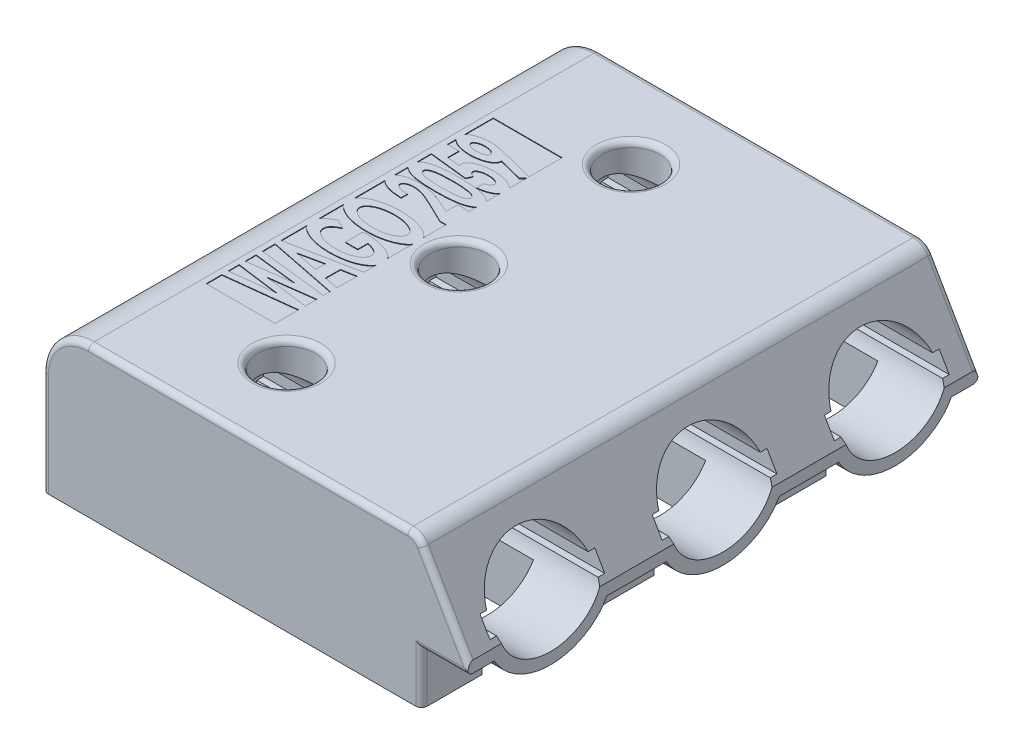
from build123d import *

# Parameters (mm, degrees)
SKETCH1_W           = 7.4
SKETCH1_H           = 8.9
BOSS_EXTRUDE1_DEPTH = 2.6
SKETCH2_RX          = 0.9
SKETCH2_RY          = 0.8
CUT_EXTRUDE1_DEPTH  = 6
CUT_EXTRUDE2_REACH  = 13.863
SKETCH3_R           = 0.5
SKETCH4_W           = 2
SKETCH4_H           = 0.3
CUT_EXTRUDE3_DEPTH  = 6
CHAMFER2_SIZE       = 1.5
CHAMFER2_SIZE_2     = 0.866025404
SKETCH5_W           = 5.5
SKETCH5_H           = 1.6
CUT_EXTRUDE4_DEPTH  = 0.4
SKETCH6_W           = 0.8
SKETCH6_H           = 0.8
SKETCH6_W_2         = 1.1
CUT_EXTRUDE5_DEPTH  = 0.2
CUT_EXTRUDE6_REACH  = 13.782
SKETCH7_W           = 3.6
SKETCH7_H           = 1.6
FILLET1_R           = 0.8
FILLET2_R           = 0.1
CUT_EXTRUDE7_DEPTH  = 0.8
FILLET3_R           = 0.1
FILLET4_R           = 0.3
SKETCH10_W          = 1.2
SKETCH10_H          = 5
CUT_EXTRUDE8_DEPTH  = 0.01
BOSS_EXTRUDE2_DEPTH = 0.01


with BuildPart() as part:
    # Sketch1 → Boss-Extrude1 (new body)
    with BuildSketch(Plane(origin=(0, 0, 0), x_dir=(1, 0, 0), z_dir=(0, 1, 0))):
        with Locations((3.7, 4.45)):
            Rectangle(SKETCH1_W, SKETCH1_H)
    extrude(amount=BOSS_EXTRUDE1_DEPTH)

    # Sketch2 → Cut-Extrude1 (cut)
    with BuildSketch(Plane(origin=(7.4, 0, 0), x_dir=(0, 0, -1), z_dir=(1, 0, 0))):
        with Locations((1.45, 1.35)):
            Ellipse(SKETCH2_RX, SKETCH2_RY)
        with Locations((4.45, 1.35)):
            Ellipse(SKETCH2_RX, SKETCH2_RY)
        with Locations((7.45, 1.35)):
            Ellipse(SKETCH2_RX, SKETCH2_RY)
    extrude(amount=-CUT_EXTRUDE1_DEPTH, mode=Mode.SUBTRACT)

    # Sketch3 → Cut-Extrude2 (cut, up to next)
    with BuildSketch(Plane(origin=(0, 2.6, 0), x_dir=(1, 0, 0), z_dir=(0, 1, 0)), mode=Mode.PRIVATE) as cut_extrude2_sk1:
        with Locations(Location((2.8, 1.45, 0), (0, 0, 270))):
            Circle(SKETCH3_R)
    cut_extrude2_tool1 = extrude(cut_extrude2_sk1.sketch, amount=-CUT_EXTRUDE2_REACH, mode=Mode.PRIVATE) & part.part
    # Sketch3 → Cut-Extrude2 (cut, up to next)
    with BuildSketch(Plane(origin=(0, 2.6, 0), x_dir=(1, 0, 0), z_dir=(0, 1, 0)), mode=Mode.PRIVATE) as cut_extrude2_sk2:
        with Locations(Location((2.8, 4.45, 0), (0, 0, 270))):
            Circle(SKETCH3_R)
    cut_extrude2_tool2 = extrude(cut_extrude2_sk2.sketch, amount=-CUT_EXTRUDE2_REACH, mode=Mode.PRIVATE) & part.part
    # Sketch3 → Cut-Extrude2 (cut, up to next)
    with BuildSketch(Plane(origin=(0, 2.6, 0), x_dir=(1, 0, 0), z_dir=(0, 1, 0)), mode=Mode.PRIVATE) as cut_extrude2_sk3:
        with Locations(Location((2.8, 7.45, 0), (0, 0, 270))):
            Circle(SKETCH3_R)
    cut_extrude2_tool3 = extrude(cut_extrude2_sk3.sketch, amount=-CUT_EXTRUDE2_REACH, mode=Mode.PRIVATE) & part.part
    add(cut_extrude2_tool1.solids().sort_by_distance((2.8, 2.6, -1.45))[0], mode=Mode.SUBTRACT)
    add(cut_extrude2_tool2.solids().sort_by_distance((2.8, 2.6, -4.45))[0], mode=Mode.SUBTRACT)
    add(cut_extrude2_tool3.solids().sort_by_distance((2.8, 2.6, -7.45))[0], mode=Mode.SUBTRACT)

    # Sketch4 → Cut-Extrude3 (cut)
    with BuildSketch(Plane(origin=(7.4, 0, 0), x_dir=(0, 0, -1), z_dir=(1, 0, 0))):
        with Locations((1.45, 1.35)):
            Rectangle(SKETCH4_W, SKETCH4_H)
        with Locations((4.45, 1.35)):
            Rectangle(SKETCH4_W, SKETCH4_H)
        with Locations((7.45, 1.35)):
            Rectangle(SKETCH4_W, SKETCH4_H)
    extrude(amount=-CUT_EXTRUDE3_DEPTH, mode=Mode.SUBTRACT)

    # Chamfer2
    # the kernel refuses this chamfer: 1.5, 0.866025404 mm, written as the material it takes off along each edge
    with BuildSketch(Plane(origin=(7.4, 2.6, 3.880628632), x_dir=(0.019326765612700865, -0.999813220622208, 0), z_dir=(0, 0, -1))) as chamfer2_piece_1:
        Polygon((CHAMFER2_SIZE * 0.999813220622, CHAMFER2_SIZE * 0.0193267656127), (-CHAMFER2_SIZE_2 * 0.0193267656079, CHAMFER2_SIZE_2 * 0.999813220373), (0, 0), align=None)
    extrude(amount=16.661257264, mode=Mode.SUBTRACT)

    # Sketch5 → Cut-Extrude4 (cut)
    with BuildSketch(Plane.XZ):
        with Locations((3.55, -7.45)):
            Rectangle(SKETCH5_W, SKETCH5_H)
        with Locations((3.55, -4.45)):
            Rectangle(SKETCH5_W, SKETCH5_H)
        with Locations((3.55, -1.45)):
            Rectangle(SKETCH5_W, SKETCH5_H)
    extrude(amount=-CUT_EXTRUDE4_DEPTH, mode=Mode.SUBTRACT)

    # Sketch6 → Cut-Extrude5 (cut)
    with BuildSketch(Plane.XZ):
        with Locations((0.4, -7.45)):
            Rectangle(SKETCH6_W, SKETCH6_H)
        with Locations((0.4, -4.45)):
            Rectangle(SKETCH6_W, SKETCH6_H)
        with Locations((0.4, -1.45)):
            Rectangle(SKETCH6_W, SKETCH6_H)
        with Locations((6.85, -7.45)):
            Rectangle(SKETCH6_W_2, SKETCH6_H)
        with Locations((6.85, -4.45)):
            Rectangle(SKETCH6_W_2, SKETCH6_H)
        with Locations((6.85, -1.45)):
            Rectangle(SKETCH6_W_2, SKETCH6_H)
    extrude(amount=-CUT_EXTRUDE5_DEPTH, mode=Mode.SUBTRACT)

    # Sketch7 → Cut-Extrude6 (cut, up to next)
    with BuildSketch(Plane.XZ.offset(-0.4), mode=Mode.PRIVATE) as cut_extrude6_sk1:
        with Locations((4.5, -7.45)):
            Rectangle(SKETCH7_W, SKETCH7_H)
    cut_extrude6_tool1 = extrude(cut_extrude6_sk1.sketch, amount=-CUT_EXTRUDE6_REACH, mode=Mode.PRIVATE) & part.part
    # Sketch7 → Cut-Extrude6 (cut, up to next)
    with BuildSketch(Plane.XZ.offset(-0.4), mode=Mode.PRIVATE) as cut_extrude6_sk2:
        with Locations((4.5, -4.45)):
            Rectangle(SKETCH7_W, SKETCH7_H)
    cut_extrude6_tool2 = extrude(cut_extrude6_sk2.sketch, amount=-CUT_EXTRUDE6_REACH, mode=Mode.PRIVATE) & part.part
    # Sketch7 → Cut-Extrude6 (cut, up to next)
    with BuildSketch(Plane.XZ.offset(-0.4), mode=Mode.PRIVATE) as cut_extrude6_sk3:
        with Locations((4.5, -1.45)):
            Rectangle(SKETCH7_W, SKETCH7_H)
    cut_extrude6_tool3 = extrude(cut_extrude6_sk3.sketch, amount=-CUT_EXTRUDE6_REACH, mode=Mode.PRIVATE) & part.part
    add(cut_extrude6_tool1.solids().sort_by_distance((4.5, 0.4, -7.45))[0], mode=Mode.SUBTRACT)
    add(cut_extrude6_tool2.solids().sort_by_distance((4.5, 0.4, -4.45))[0], mode=Mode.SUBTRACT)
    add(cut_extrude6_tool3.solids().sort_by_distance((4.5, 0.4, -1.45))[0], mode=Mode.SUBTRACT)

    # Fillet1
    fillet1_edges = [part.edges().sort_by_distance(p)[0] for p in [
        (0, 2.6, -4.45),
    ]]
    fillet(fillet1_edges, radius=FILLET1_R)

    # Fillet2
    fillet2_edges = [part.edges().sort_by_distance(p)[0] for p in [
        (2.8, 2.6, -1.95),
        (2.8, 2.6, -4.95),
        (2.8, 2.6, -7.95),
    ]]
    fillet(fillet2_edges, radius=FILLET2_R)

    # Sketch8 → Cut-Extrude7 (cut)
    with BuildSketch(Plane(origin=(7.4, 0, 0), x_dir=(0, 0, -1), z_dir=(1, 0, 0))):
        with BuildLine():
            Line((0, 0), (0, 0.9))
            Line((0, 0.9), (0.46766859, 0.9))
            add(Edge.make_bspline(
                [(0.46766859, 0.9), (1.45, -0.872222222), (2.43233141, 0.9)],
                knots=[3.608357993, 3.608357993, 3.608357993, 5.816419968, 5.816419968, 5.816419968], degree=2, weights=[1, 0.45, 1]))
            Line((2.43233141, 0.9), (3.46766859, 0.9))
            add(Edge.make_bspline(
                [(3.46766859, 0.9), (4.45, -0.872222222), (5.43233141, 0.9)],
                knots=[0.466765339, 0.466765339, 0.466765339, 2.674827315, 2.674827315, 2.674827315], degree=2, weights=[1, 0.45, 1]))
            Line((5.43233141, 0.9), (6.46766859, 0.9))
            add(Edge.make_bspline(
                [(6.46766859, 0.9), (7.45, -0.872222222), (8.43233141, 0.9)],
                knots=[0.466765339, 0.466765339, 0.466765339, 2.674827315, 2.674827315, 2.674827315], degree=2, weights=[1, 0.45, 1]))
            Line((8.43233141, 0.9), (8.9, 0.9))
            Line((8.9, 0.9), (8.9, 0))
            Line((8.9, 0), (0, 0))
        make_face()
    extrude(amount=-CUT_EXTRUDE7_DEPTH, mode=Mode.SUBTRACT)

    # Fillet3
    # the kernel refuses this fillet: 0.1 mm, written as the material it takes off along each edge
    with BuildSketch(Plane(origin=(0, -0.25, -8.9), x_dir=(1, 0, 0), z_dir=(0, 1, 0))) as fillet3_piece_1:
        with BuildLine():
            CenterArc((FILLET3_R, -FILLET3_R), FILLET3_R, 90, 90)
            Line((0, -FILLET3_R), (0, 0))
            Line((0, 0), (FILLET3_R, 0))
        make_face()
    extrude(amount=2.05, mode=Mode.SUBTRACT)
    with BuildSketch(Plane(origin=(0.8, 1.8, -8.9), x_dir=(-1, 0, 0), z_dir=(0, -1, 0))) as fillet3_piece_2:
        with BuildLine():
            CenterArc((0.8 - FILLET3_R, -FILLET3_R), FILLET3_R, 0, 90)
            Line((0.8, -FILLET3_R), (0.8, 0))
            Line((0.8, 0), (0.8 - FILLET3_R, 0))
        make_face()
    revolve(axis=Axis((0.8, 1.8, -8.9), (0, 0, -1)), revolution_arc=90, mode=Mode.SUBTRACT)
    with BuildSketch(Plane(origin=(0, -0.25, 0), x_dir=(1, 0, 0), z_dir=(0, 1, 0))) as fillet3_piece_3:
        with BuildLine():
            CenterArc((FILLET3_R, FILLET3_R), FILLET3_R, 180, 90)
            Line((0, FILLET3_R), (0, 0))
            Line((0, 0), (FILLET3_R, 0))
        make_face()
    extrude(amount=2.05, mode=Mode.SUBTRACT)
    with BuildSketch(Plane(origin=(0.8, 1.8, 0), x_dir=(-1, 0, 0), z_dir=(0, -1, 0))) as fillet3_piece_4:
        with BuildLine():
            CenterArc((0.8 - FILLET3_R, FILLET3_R), FILLET3_R, 270, 90)
            Line((0.8 - FILLET3_R, 0), (0.8, 0))
            Line((0.8, 0), (0.8, FILLET3_R))
        make_face()
    revolve(axis=Axis((0.8, 1.8, 0), (0, 0, -1)), revolution_arc=90, mode=Mode.SUBTRACT)
    with BuildSketch(Plane(origin=(6.6, 0.9, -8.9), x_dir=(-1, 0, 0), z_dir=(0, -1, 0)), Plane(origin=(6.6, -0.25, 0), x_dir=(-1, 0, 0), z_dir=(0, 1, 0))) as fillet3_piece_5:
        with BuildLine():
            CenterArc((FILLET3_R, -FILLET3_R), FILLET3_R, 90, 90)
            Line((0, -FILLET3_R), (0, 0))
            Line((0, 0), (FILLET3_R, 0))
        make_face()
    extrude(amount=1.15, mode=Mode.SUBTRACT)
    with BuildSketch(Plane(origin=(7.65, 0.9, -8.9), x_dir=(0, 1, 0), z_dir=(-1, 0, 0))) as fillet3_piece_6:
        with BuildLine():
            CenterArc((FILLET3_R, -FILLET3_R), FILLET3_R, 90, 90)
            Line((0, -FILLET3_R), (0, 0))
            Line((0, 0), (FILLET3_R, 0))
        make_face()
    extrude(amount=1.05, mode=Mode.SUBTRACT)
    with BuildSketch(Plane(origin=(6.783974596, 2.6, -8.9), x_dir=(0, 0, 1), z_dir=(-1, 0, 0)), Plane(origin=(0.8, 2.6, 0), x_dir=(0, 0, -1), z_dir=(1, 0, 0))) as fillet3_piece_7:
        with BuildLine():
            CenterArc((FILLET3_R, -FILLET3_R), FILLET3_R, 90, 90)
            Line((0, -FILLET3_R), (0, 0))
            Line((0, 0), (FILLET3_R, 0))
        make_face()
    extrude(amount=5.983974596, mode=Mode.SUBTRACT)
    with BuildSketch(Plane(origin=(7.525, 0.883493649, -8.9), x_dir=(-0.8660254037843199, -0.5000000000002054, 0), z_dir=(-0.5000000000002055, 0.8660254037843201, 0))) as fillet3_piece_8:
        with BuildLine():
            CenterArc((FILLET3_R, FILLET3_R), FILLET3_R, 180, 90)
            Line((0, FILLET3_R), (0, 0))
            Line((0, 0), (FILLET3_R, 0))
        make_face()
    extrude(amount=2.232050808, mode=Mode.SUBTRACT)
    with BuildSketch(Plane(origin=(7.65, 0.9, 0), x_dir=(0, 1, 0), z_dir=(-1, 0, 0))) as fillet3_piece_9:
        with BuildLine():
            CenterArc((FILLET3_R, FILLET3_R), FILLET3_R, 180, 90)
            Line((0, FILLET3_R), (0, 0))
            Line((0, 0), (FILLET3_R, 0))
        make_face()
    extrude(amount=1.05, mode=Mode.SUBTRACT)
    with BuildSketch(Plane(origin=(6.408974596, 2.816506351, 0), x_dir=(0, 0, -1), z_dir=(0.5000000000002055, -0.8660254037843201, 0))) as fillet3_piece_10:
        with BuildLine():
            CenterArc((FILLET3_R, -FILLET3_R), FILLET3_R, 90, 90)
            Line((0, -FILLET3_R), (0, 0))
            Line((0, 0), (FILLET3_R, 0))
        make_face()
    extrude(amount=2.232050808, mode=Mode.SUBTRACT)
    with BuildSketch(Plane(origin=(7.65, 0.9, -8.9), x_dir=(0, 1, 0), z_dir=(-1, 0, 0))) as fillet3_piece_11a_section:
        with BuildLine():
            CenterArc((FILLET3_R, -FILLET3_R), FILLET3_R, 90, 90)
            Line((0, -FILLET3_R), (0, 0))
            Line((0, 0), (FILLET3_R, 0))
        make_face()
    fillet3_piece_11a = extrude(amount=1.3, mode=Mode.PRIVATE)
    fillet3_piece_11a = split(fillet3_piece_11a, bisect_by=Plane(origin=(6.6, 0.922639511, -8.877360489), z_dir=(-1, 0, 0)), keep=Keep.TOP, mode=Mode.PRIVATE)
    with BuildSketch(Plane(origin=(6.6, 1.15, -8.9), x_dir=(-1, 0, 0), z_dir=(0, -1, 0))) as fillet3_piece_11b_section:
        with BuildLine():
            CenterArc((FILLET3_R, -FILLET3_R), FILLET3_R, 90, 90)
            Line((0, -FILLET3_R), (0, 0))
            Line((0, 0), (FILLET3_R, 0))
        make_face()
    fillet3_piece_11b = extrude(amount=1.4, mode=Mode.PRIVATE)
    fillet3_piece_11b = split(fillet3_piece_11b, bisect_by=Plane(origin=(6.577360489, 0.9, -8.877360489), z_dir=(0, 1, 0)), keep=Keep.TOP, mode=Mode.PRIVATE)
    fillet3_piece_11 = fillet3_piece_11a & fillet3_piece_11b
    add(fillet3_piece_11, mode=Mode.SUBTRACT)
    with BuildSketch(Plane(origin=(6.6, -0.25, 0), x_dir=(-1, 0, 0), z_dir=(0, 1, 0))) as fillet3_piece_12a_section:
        with BuildLine():
            CenterArc((FILLET3_R, -FILLET3_R), FILLET3_R, 90, 90)
            Line((0, -FILLET3_R), (0, 0))
            Line((0, 0), (FILLET3_R, 0))
        make_face()
    fillet3_piece_12a = extrude(amount=1.4, mode=Mode.PRIVATE)
    fillet3_piece_12a = split(fillet3_piece_12a, bisect_by=Plane(origin=(6.577360489, 0.9, -0.022639511), z_dir=(0, 1, 0)), keep=Keep.TOP, mode=Mode.PRIVATE)
    with BuildSketch(Plane(origin=(7.65, 0.9, 0), x_dir=(0, 1, 0), z_dir=(-1, 0, 0))) as fillet3_piece_12b_section:
        with BuildLine():
            CenterArc((FILLET3_R, FILLET3_R), FILLET3_R, 180, 90)
            Line((0, FILLET3_R), (0, 0))
            Line((0, 0), (FILLET3_R, 0))
        make_face()
    fillet3_piece_12b = extrude(amount=1.3, mode=Mode.PRIVATE)
    fillet3_piece_12b = split(fillet3_piece_12b, bisect_by=Plane(origin=(6.6, 0.922639511, -0.022639511), z_dir=(-1, 0, 0)), keep=Keep.TOP, mode=Mode.PRIVATE)
    fillet3_piece_12 = fillet3_piece_12a & fillet3_piece_12b
    add(fillet3_piece_12, mode=Mode.SUBTRACT)

    # Fillet4
    # the kernel refuses this fillet: 0.3 mm, written as the material it takes off along each edge
    with BuildSketch(Plane(origin=(6.360769515, 2.3, -8.9), x_dir=(0, 1, 0), z_dir=(-1, 0, 0))) as fillet4_piece_1:
        with BuildLine():
            CenterArc((0.2, -0.1), 0.1, 0, 90)
            Line((0.3, -0.1), (0.3, 0))
            Line((0.3, 0), (0.2, 0))
        make_face()
    revolve(axis=Axis((6.360769515, 2.3, -8.9), (0, 0, -1)), revolution_arc=60, mode=Mode.SUBTRACT)
    with BuildSketch(Plane(origin=(6.360769515, 2.3, 0), x_dir=(0.8660254037843201, 0.5000000000002055, 0), z_dir=(0.5000000000002055, -0.8660254037843201, 0))) as fillet4_piece_2:
        with BuildLine():
            CenterArc((0.2, -0.1), 0.1, 0, 90)
            Line((0.3, -0.1), (0.3, 0))
            Line((0.3, 0), (0.2, 0))
        make_face()
    revolve(axis=Axis((6.360769515, 2.3, 0), (0, 0, 1)), revolution_arc=60, mode=Mode.SUBTRACT)
    with BuildSketch(Plane(origin=(6.533974596, 2.6, 0), x_dir=(-1, 0, 0), z_dir=(0, 0, -1))) as fillet4_piece_3:
        with BuildLine():
            CenterArc((FILLET4_R * 0.577350269189, -FILLET4_R), FILLET4_R, 90, 60)
            Line((-FILLET4_R * 0.288675134595, -FILLET4_R * 0.5), (0, 0))
            Line((0, 0), (FILLET4_R * 0.577350269189, 0))
        make_face()
    extrude(amount=8.9, mode=Mode.SUBTRACT)

    # Sketch10 → Cut-Extrude8 (cut)
    with BuildSketch(Plane(origin=(0, 2.6, 0), x_dir=(1, 0, 0), z_dir=(0, 1, 0))):
        with Locations((1.5, 4.45)):
            Rectangle(SKETCH10_W, SKETCH10_H)
    extrude(amount=-CUT_EXTRUDE8_DEPTH, mode=Mode.SUBTRACT)

    # Sketch13 → Boss-Extrude2 (add)
    # profile 1 of 8: a face of its own
    with BuildSketch(Plane(origin=(0, 2.59, 0), x_dir=(1, 0, 0), z_dir=(0, 1, 0))):
        Polygon((0.9, 2.222307692), (0.9, 2.333846154), (1.666105769, 2.422307692), (0.9, 2.52375), (0.9, 2.628798077), (1.666105769, 2.73), (0.9, 2.818461538), (0.9, 2.93), (2.1, 2.791298077), (2.1, 2.678557692), (1.324278846, 2.576153846), (2.1, 2.473509615), (2.1, 2.361009615), align=None)
    # profile 2 of 8: a face of its own
    with BuildSketch(Plane(origin=(0, 2.59, 0), x_dir=(1, 0, 0), z_dir=(0, 1, 0))):
        Polygon((0.9, 3.151586538), (0.9, 3.253028846), (2.1, 3.494615385), (2.1, 3.378990385), (1.853846154, 3.332115385), (1.853846154, 3.0725), (2.1, 3.025625), (2.1, 2.91), align=None)
        Polygon((1.221875, 3.202307692), (1.638461538, 3.113365385), (1.638461538, 3.29125), align=None, mode=Mode.SUBTRACT)
    # profile 3 of 8: a face of its own
    with BuildSketch(Plane(origin=(0, 2.59, 0), x_dir=(1, 0, 0), z_dir=(0, 1, 0))):
        with BuildLine():
            Line((1.090865385, 4.054182692), (1.246875, 3.976778846))
            add(Edge.make_bspline(
                [(1.246875, 3.976778846), (1.234113128, 3.970726395), (1.209824285, 3.959207157), (1.176738348, 3.939704903), (1.148600079, 3.919570842), (1.125345315, 3.898639719), (1.107263782, 3.876624256), (1.094132028, 3.853802138), (1.086274134, 3.829924447), (1.085166057, 3.813691939), (1.084615385, 3.805625)],
                knots=[0, 0, 0, 0, 1.361920701, 2.592055208, 3.69903326, 4.694692089, 5.601252762, 6.435327087, 7.222417069, 8, 8, 8, 8], degree=3))
            add(Edge.make_bspline(
                [(1.084615385, 3.805625), (1.084998463, 3.798618614), (1.085759187, 3.784705222), (1.091507463, 3.764354956), (1.101174068, 3.745125719), (1.114376509, 3.726630569), (1.131405836, 3.709125124), (1.152064107, 3.692428731), (1.176574257, 3.676965815), (1.204180799, 3.662192061), (1.23454043, 3.648948418), (1.266774932, 3.637104864), (1.30075871, 3.627266703), (1.336357729, 3.619435699), (1.373425669, 3.61320252), (1.412081809, 3.608575671), (1.45236813, 3.605988342), (1.479804169, 3.605588073), (1.49375, 3.605384615)],
                knots=[0, 0, 0, 0, 0.679652903, 1.349665488, 2.035037498, 2.760306981, 3.547092095, 4.398772552, 5.333128833, 6.356333698, 7.436085785, 8.546017941, 9.688328171, 10.867935235, 12.082898791, 13.336329278, 14.646047217, 16, 16, 16, 16], degree=3))
            add(Edge.make_bspline(
                [(1.49375, 3.605384615), (1.508176775, 3.605584658), (1.536493854, 3.605977304), (1.578136241, 3.608606298), (1.618096464, 3.613143686), (1.656391537, 3.619583255), (1.692956539, 3.628060712), (1.727936404, 3.638050069), (1.761135106, 3.650142864), (1.792416624, 3.66367913), (1.82102232, 3.678459295), (1.845946173, 3.694714654), (1.867366221, 3.711439227), (1.884881136, 3.729214941), (1.898409216, 3.748053724), (1.908224832, 3.767722852), (1.914279454, 3.788444321), (1.915016173, 3.802621406), (1.915384615, 3.809711538)],
                knots=[0, 0, 0, 0, 1.362629156, 2.674587977, 3.939127299, 5.159712617, 6.340196588, 7.48270814, 8.593572761, 9.674806199, 10.700554302, 11.630500185, 12.481521052, 13.262926739, 13.979080885, 14.6627873, 15.331243728, 16, 16, 16, 16], degree=3))
            add(Edge.make_bspline(
                [(1.915384615, 3.809711538), (1.914708163, 3.818766506), (1.913363915, 3.836760557), (1.903343348, 3.862551587), (1.88609761, 3.885381694), (1.867232164, 3.902102418), (1.848944161, 3.91421059), (1.833195004, 3.923342035), (1.815468268, 3.931747248), (1.795902697, 3.93958617), (1.774646066, 3.947360965), (1.751366536, 3.954159577), (1.726439325, 3.961074043), (1.708997437, 3.96477404), (1.7, 3.966682692)],
                knots=[0, 0, 0, 0, 1.129868139, 2.245276511, 3.398537484, 4.674593475, 5.374234604, 6.136589239, 6.946983331, 7.822518843, 8.76926428, 9.773133812, 10.851266075, 12, 12, 12, 12], degree=3))
            Line((1.7, 3.966682692), (1.7, 3.79))
            Line((1.7, 3.79), (1.484615385, 3.79))
            Line((1.484615385, 3.79), (1.484615385, 4.096971154))
            Line((1.484615385, 4.096971154), (1.535817308, 4.097692308))
            add(Edge.make_bspline(
                [(1.535817308, 4.097692308), (1.562038231, 4.097265816), (1.613867305, 4.096422801), (1.690545607, 4.088642973), (1.765173237, 4.076540966), (1.825520881, 4.06221257), (1.871885267, 4.048887286), (1.904339976, 4.037673217), (1.934882685, 4.026251873), (1.963331338, 4.014149496), (1.989307229, 4.000705086), (2.013556996, 3.987126914), (2.035526061, 3.972524313), (2.055422072, 3.95732999), (2.073143522, 3.941436117), (2.088483921, 3.92465766), (2.101571082, 3.90729548), (2.112384106, 3.88931978), (2.120537909, 3.870541854), (2.126304516, 3.851080113), (2.130113348, 3.831013399), (2.130549069, 3.817341063), (2.130769231, 3.810432692)],
                knots=[0, 0, 0, 0, 2.191556367, 4.331896909, 6.436463578, 8.508160572, 9.512991909, 10.468398122, 11.377892299, 12.239030084, 13.050921644, 13.821991032, 14.561451018, 15.254161397, 15.913413803, 16.5487837, 17.151682502, 17.728408617, 18.298403811, 18.857910326, 19.422923848, 20, 20, 20, 20], degree=3))
            add(Edge.make_bspline(
                [(2.130769231, 3.810432692), (2.13055338, 3.803045761), (2.130123377, 3.788329992), (2.126187996, 3.766580524), (2.119475362, 3.745581617), (2.110986792, 3.724890053), (2.099198908, 3.705223769), (2.085153674, 3.686030597), (2.06841373, 3.667596833), (2.049504633, 3.64951209), (2.027936568, 3.632545592), (2.004384637, 3.616174546), (1.978652798, 3.600733285), (1.950503327, 3.586726433), (1.920654726, 3.572917277), (1.888432567, 3.560419003), (1.8540372, 3.549009835), (1.80512603, 3.534424994), (1.740969918, 3.519818419), (1.661242779, 3.507043484), (1.57860152, 3.499222961), (1.522452812, 3.498207206), (1.493990385, 3.497692308)],
                knots=[0, 0, 0, 0, 0.573670051, 1.142828421, 1.710008053, 2.284758336, 2.876360408, 3.48657501, 4.130333195, 4.808577387, 5.51745281, 6.26013984, 7.036439283, 7.846751067, 8.702144451, 9.5912933, 10.530482835, 11.517492748, 13.556441166, 15.6374695, 17.788582953, 20, 20, 20, 20], degree=3))
            add(Edge.make_bspline(
                [(1.493990385, 3.497692308), (1.474432376, 3.497906798), (1.435923411, 3.498329122), (1.379157381, 3.502150872), (1.324318819, 3.507629297), (1.271507167, 3.516273126), (1.220502005, 3.526656479), (1.171522744, 3.539742698), (1.124262864, 3.554673416), (1.094073982, 3.567035734), (1.079086538, 3.573173077)],
                knots=[0, 0, 0, 0, 1.105508345, 2.176703252, 3.215208542, 4.219828467, 5.200615773, 6.156526059, 7.084796789, 8, 8, 8, 8], degree=3))
            add(Edge.make_bspline(
                [(1.079086538, 3.573173077), (1.062522384, 3.580664025), (1.031001111, 3.594919157), (0.987996288, 3.619718192), (0.951725773, 3.646431205), (0.921512059, 3.674545009), (0.89824758, 3.704958547), (0.881634672, 3.737075193), (0.871137749, 3.771005031), (0.869870365, 3.794333072), (0.869230769, 3.806105769)],
                knots=[0, 0, 0, 0, 1.310870632, 2.494562166, 3.573149468, 4.554369943, 5.461862654, 6.320123467, 7.15223579, 8, 8, 8, 8], degree=3))
            add(Edge.make_bspline(
                [(0.869230769, 3.806105769), (0.869946574, 3.818441122), (0.87138576, 3.843242402), (0.882540955, 3.879566132), (0.900580629, 3.91457887), (0.917313955, 3.935459262), (0.925961538, 3.94625)],
                knots=[0, 0, 0, 0, 0.957383094, 1.924900493, 2.927613206, 4, 4, 4, 4], degree=3))
            add(Edge.make_bspline(
                [(0.925961538, 3.94625), (0.930204858, 3.950902266), (0.939079821, 3.960632546), (0.954628301, 3.974065556), (0.971912114, 3.987985167), (0.991733549, 4.001214947), (1.013413313, 4.014761233), (1.037204592, 4.028212531), (1.063246506, 4.041405519), (1.081463107, 4.049832967), (1.090865385, 4.054182692)],
                knots=[0, 0, 0, 0, 0.760855217, 1.591339432, 2.481209364, 3.443428389, 4.470596073, 5.572775427, 6.747217491, 8, 8, 8, 8], degree=3))
        make_face()
    # profile 4 of 8: a face of its own
    with BuildSketch(Plane(origin=(0, 2.59, 0), x_dir=(1, 0, 0), z_dir=(0, 1, 0))):
        with BuildLine():
            add(Edge.make_bspline(
                [(0.869230769, 4.440432692), (0.869784906, 4.45051072), (0.870896124, 4.470720317), (0.880047432, 4.500275237), (0.894826974, 4.528570919), (0.915364244, 4.555697043), (0.941787226, 4.581378457), (0.973537061, 4.606318461), (1.011376251, 4.629655759), (1.054213819, 4.651945142), (1.101213214, 4.672388577), (1.151224094, 4.690410208), (1.203817976, 4.705583744), (1.258928705, 4.717714615), (1.316538001, 4.727328338), (1.376622963, 4.734274441), (1.43928545, 4.738376293), (1.481884904, 4.738942214), (1.503605769, 4.739230769)],
                knots=[0, 0, 0, 0, 0.637516253, 1.278419498, 1.941441253, 2.652191828, 3.424014167, 4.270027338, 5.205314781, 6.236240679, 7.327514337, 8.450036079, 9.602064735, 10.793131996, 12.023360842, 13.301068925, 14.623852794, 16, 16, 16, 16], degree=3))
            add(Edge.make_bspline(
                [(1.503605769, 4.739230769), (1.525086694, 4.738945512), (1.567286668, 4.738385116), (1.629294264, 4.734228009), (1.688820837, 4.727541264), (1.745828204, 4.718274181), (1.800285119, 4.706086024), (1.852048968, 4.690773945), (1.901551983, 4.673386154), (1.947927448, 4.653104801), (1.990400117, 4.63116548), (2.027626021, 4.607655053), (2.05922935, 4.583059208), (2.0854954, 4.557434498), (2.105348576, 4.529844556), (2.120240449, 4.501595209), (2.12908132, 4.471722337), (2.130204224, 4.451386267), (2.130769231, 4.441153846)],
                knots=[0, 0, 0, 0, 1.372060885, 2.695458134, 3.967787108, 5.19714985, 6.38298384, 7.529699334, 8.643501638, 9.732278966, 10.76020068, 11.694491913, 12.540243682, 13.314756398, 14.029366446, 14.702365904, 15.347074562, 16, 16, 16, 16], degree=3))
            add(Edge.make_bspline(
                [(2.130769231, 4.441153846), (2.130246738, 4.430509305), (2.129202793, 4.409241452), (2.119686821, 4.378349873), (2.105141128, 4.348717039), (2.084115622, 4.320819967), (2.057381173, 4.294359359), (2.024818879, 4.269368466), (1.986570962, 4.245854003), (1.943089171, 4.224166455), (1.895825964, 4.20416043), (1.845548873, 4.186956779), (1.793278004, 4.171988704), (1.738666001, 4.160014343), (1.682008318, 4.150721071), (1.623135571, 4.143921976), (1.562068631, 4.140164411), (1.52059779, 4.139545398), (1.499519231, 4.139230769)],
                knots=[0, 0, 0, 0, 0.67227531, 1.343209937, 2.02824109, 2.753566107, 3.542596411, 4.402938216, 5.345963044, 6.380318996, 7.475899779, 8.592310316, 9.74187213, 10.915880365, 12.129125454, 13.37483464, 14.665696157, 16, 16, 16, 16], degree=3))
            add(Edge.make_bspline(
                [(1.499519231, 4.139230769), (1.471373206, 4.139617569), (1.416173039, 4.140376162), (1.33511968, 4.148548678), (1.257370558, 4.16041202), (1.195195088, 4.175058115), (1.147995334, 4.18943751), (1.114492937, 4.200507334), (1.083076864, 4.213144132), (1.053393707, 4.226268472), (1.025692967, 4.240455093), (0.999870912, 4.255662405), (0.975814525, 4.271716562), (0.953715308, 4.288643858), (0.934087366, 4.306469545), (0.916660203, 4.324343994), (0.902033323, 4.342766308), (0.890201693, 4.361672306), (0.880685964, 4.380773392), (0.874214124, 4.400377218), (0.869783837, 4.420200842), (0.869415421, 4.433677905), (0.869230769, 4.440432692)],
                knots=[0, 0, 0, 0, 2.23530455, 4.383893761, 6.465522073, 8.480508351, 9.451205066, 10.385266449, 11.282483849, 12.140192061, 12.962983267, 13.753420562, 14.519674305, 15.259451087, 15.962577347, 16.624406907, 17.2408063, 17.827186538, 18.393743277, 18.931229962, 19.464325837, 20, 20, 20, 20], degree=3))
        make_face()
        with BuildLine():
            add(Edge.make_bspline(
                [(1.084615385, 4.43875), (1.084990462, 4.432058449), (1.085735648, 4.418763995), (1.091627556, 4.399383621), (1.100900516, 4.380806868), (1.114123625, 4.363203635), (1.131014185, 4.34655511), (1.151439047, 4.330628532), (1.175559281, 4.315575653), (1.203125448, 4.30157813), (1.233411734, 4.288752472), (1.265971787, 4.277357593), (1.300571073, 4.268145359), (1.337096481, 4.260479633), (1.375570946, 4.254140428), (1.416104798, 4.249908706), (1.458626023, 4.247568939), (1.487577291, 4.247141816), (1.502403846, 4.246923077)],
                knots=[0, 0, 0, 0, 0.644157655, 1.279781809, 1.936191005, 2.637648545, 3.391472867, 4.216725539, 5.129763252, 6.12824998, 7.19434655, 8.298635566, 9.451131417, 10.643532913, 11.895767469, 13.2086995, 14.57051607, 16, 16, 16, 16], degree=3))
            add(Edge.make_bspline(
                [(1.502403846, 4.246923077), (1.518834079, 4.247190522), (1.550923106, 4.247712855), (1.59772408, 4.250701859), (1.641940574, 4.256261611), (1.683421922, 4.263935222), (1.722393808, 4.273375645), (1.758506241, 4.28549923), (1.792169059, 4.299474433), (1.812915957, 4.310993202), (1.823076923, 4.316634615)],
                knots=[0, 0, 0, 0, 1.188052193, 2.320322432, 3.388902105, 4.408206494, 5.36934201, 6.285399067, 7.160259934, 8, 8, 8, 8], degree=3))
            add(Edge.make_bspline(
                [(1.823076923, 4.316634615), (1.830386639, 4.32105751), (1.844448614, 4.329565998), (1.86310921, 4.344112146), (1.87933317, 4.35873065), (1.892295881, 4.374176665), (1.902745486, 4.389966044), (1.909976136, 4.406468419), (1.914561954, 4.423519495), (1.91511043, 4.435116213), (1.915384615, 4.440913462)],
                knots=[0, 0, 0, 0, 1.262994657, 2.429670232, 3.495156254, 4.48791488, 5.405401779, 6.28655118, 7.143439651, 8, 8, 8, 8], degree=3))
            add(Edge.make_bspline(
                [(1.915384615, 4.440913462), (1.915006274, 4.447443776), (1.914254389, 4.460421573), (1.908370696, 4.479461261), (1.898781996, 4.497575042), (1.88565309, 4.515208168), (1.86813833, 4.531303784), (1.847695934, 4.547423923), (1.823029281, 4.562118709), (1.795329153, 4.576443033), (1.764663156, 4.58909205), (1.732239679, 4.600938064), (1.697775411, 4.609922172), (1.66184739, 4.618153832), (1.62397815, 4.623869889), (1.58448252, 4.628666677), (1.543133355, 4.63085731), (1.51506559, 4.631308086), (1.500721154, 4.631538462)],
                knots=[0, 0, 0, 0, 0.635067423, 1.262079513, 1.921645726, 2.623859597, 3.390916925, 4.230570082, 5.155242208, 6.181158275, 7.265099039, 8.383019208, 9.539509317, 10.730234774, 11.97064085, 13.266540165, 14.603025969, 16, 16, 16, 16], degree=3))
            add(Edge.make_bspline(
                [(1.500721154, 4.631538462), (1.486454058, 4.631343806), (1.458456071, 4.630961811), (1.417310231, 4.628258777), (1.377916459, 4.624004182), (1.340114381, 4.61797771), (1.303947263, 4.61020172), (1.269529404, 4.600162382), (1.236649908, 4.589039961), (1.205965286, 4.575844267), (1.177824018, 4.561739421), (1.153130611, 4.546537439), (1.132037081, 4.530854669), (1.114842209, 4.514059964), (1.101467048, 4.496391822), (1.091531651, 4.478004147), (1.085788935, 4.458558599), (1.085006741, 4.445355788), (1.084615385, 4.43875)],
                knots=[0, 0, 0, 0, 1.381841661, 2.711749261, 3.992229001, 5.218424283, 6.418025025, 7.572592604, 8.689369108, 9.777764434, 10.805177947, 11.735647922, 12.583183317, 13.346034268, 14.05540928, 14.72196906, 15.360560342, 16, 16, 16, 16], degree=3))
        make_face(mode=Mode.SUBTRACT)
    # profile 5 of 8: a face of its own
    with BuildSketch(Plane(origin=(0, 2.59, 0), x_dir=(1, 0, 0), z_dir=(0, 1, 0))):
        with BuildLine():
            Line((1.3, 5.053076923), (1.3, 4.945384615))
            add(Edge.make_bspline(
                [(1.3, 4.945384615), (1.283728818, 4.945915778), (1.252039255, 4.946950264), (1.205841593, 4.950287049), (1.162274958, 4.955251916), (1.12138833, 4.962038713), (1.083125072, 4.970009652), (1.047622581, 4.980011517), (1.014672748, 4.991101609), (0.984588082, 5.004027596), (0.957826427, 5.018415375), (0.934155954, 5.033434517), (0.91437948, 5.049840938), (0.89791538, 5.067070923), (0.884900592, 5.085352419), (0.876059679, 5.104907623), (0.870010051, 5.125232873), (0.869492656, 5.139250787), (0.869230769, 5.146346154)],
                knots=[0, 0, 0, 0, 1.512957992, 2.946619281, 4.303607177, 5.586691098, 6.797567838, 7.934091796, 9.012730232, 10.026782704, 10.973018614, 11.834388029, 12.627717367, 13.354727227, 14.044750917, 14.701162766, 15.342575039, 16, 16, 16, 16], degree=3))
            add(Edge.make_bspline(
                [(0.869230769, 5.146346154), (0.869752201, 5.15500356), (0.870794546, 5.172309779), (0.880386602, 5.197059584), (0.895187521, 5.220244455), (0.91613541, 5.241361655), (0.942263389, 5.260783347), (0.97368022, 5.277969952), (1.009974858, 5.29339227), (1.050806945, 5.306103545), (1.094229366, 5.316796116), (1.13888797, 5.324480799), (1.183870625, 5.329217931), (1.214011015, 5.329739249), (1.229086538, 5.33)],
                knots=[0, 0, 0, 0, 0.706530963, 1.412360715, 2.144129092, 2.946970336, 3.832834329, 4.802250828, 5.872392912, 7.057348359, 8.300332393, 9.532320971, 10.765724253, 12, 12, 12, 12], degree=3))
            add(Edge.make_bspline(
                [(1.229086538, 5.33), (1.247447718, 5.329590431), (1.284968908, 5.328753473), (1.342221636, 5.323029309), (1.401476636, 5.31346825), (1.452175971, 5.302867908), (1.494187588, 5.29197076), (1.527523483, 5.282491022), (1.562213752, 5.270960961), (1.598454852, 5.258397932), (1.635958387, 5.243813646), (1.674902998, 5.227941712), (1.715357685, 5.21068987), (1.742577676, 5.198175304), (1.756490385, 5.191778846)],
                knots=[0, 0, 0, 0, 1.202636082, 2.457594653, 3.764846585, 5.132889955, 5.848302832, 6.6074485, 7.402468271, 8.24238975, 9.119624868, 10.037734644, 10.997045009, 12, 12, 12, 12], degree=3))
            Line((1.756490385, 5.191778846), (1.9, 5.126153846))
            Line((1.9, 5.126153846), (1.9, 5.33))
            Line((1.9, 5.33), (2.1, 5.33))
            Line((2.1, 5.33), (2.1, 4.93))
            Line((2.1, 4.93), (1.990865385, 4.93))
            Line((1.990865385, 4.93), (1.612740385, 5.112451923))
            add(Edge.make_bspline(
                [(1.612740385, 5.112451923), (1.601700685, 5.117778352), (1.580262419, 5.128121877), (1.548767245, 5.142549626), (1.51885406, 5.155565393), (1.490656357, 5.167293786), (1.464096603, 5.177767938), (1.439220314, 5.186597092), (1.415972386, 5.194131199), (1.387701662, 5.202317214), (1.354325351, 5.210252207), (1.315876034, 5.21703379), (1.279424665, 5.221343752), (1.255699719, 5.221993565), (1.244230769, 5.222307692)],
                knots=[0, 0, 0, 0, 1.137790235, 2.209503009, 3.215472639, 4.165816707, 5.044284433, 5.865329583, 6.615680056, 7.312471133, 8.596980332, 9.79781478, 10.935434819, 12, 12, 12, 12], degree=3))
            add(Edge.make_bspline(
                [(1.244230769, 5.222307692), (1.233156931, 5.222059788), (1.211958544, 5.221585231), (1.181643157, 5.217208971), (1.154285571, 5.210154522), (1.13039823, 5.20020329), (1.110511971, 5.188275249), (1.095647781, 5.174226302), (1.086309949, 5.157795211), (1.085178104, 5.145973536), (1.084615385, 5.140096154)],
                knots=[0, 0, 0, 0, 1.354362055, 2.592623417, 3.738964783, 4.802429536, 5.749255182, 6.560463357, 7.284305466, 8, 8, 8, 8], degree=3))
            add(Edge.make_bspline(
                [(1.084615385, 5.140096154), (1.084823637, 5.137114675), (1.085242533, 5.13111747), (1.087951008, 5.122308774), (1.092673373, 5.114069717), (1.099108858, 5.106217176), (1.107425633, 5.09877423), (1.117516306, 5.091626019), (1.129375598, 5.084915101), (1.148080899, 5.076328261), (1.175218731, 5.067060486), (1.212343068, 5.059867836), (1.254410631, 5.054348945), (1.284273767, 5.053515712), (1.3, 5.053076923)],
                knots=[0, 0, 0, 0, 0.43013504, 0.865210773, 1.31537681, 1.791922336, 2.323712579, 2.920262848, 3.572543737, 4.286146268, 5.887075579, 7.6937019, 9.732259379, 12, 12, 12, 12], degree=3))
        make_face()
    # profile 6 of 8: a face of its own
    with BuildSketch(Plane(origin=(0, 2.59, 0), x_dir=(1, 0, 0), z_dir=(0, 1, 0))):
        with BuildLine():
            add(Edge.make_bspline(
                [(0.869230769, 5.546538462), (0.869390248, 5.551843999), (0.869707243, 5.562389747), (0.873041459, 5.577884783), (0.878046863, 5.592842156), (0.885125364, 5.607257945), (0.894402567, 5.620950632), (0.905461496, 5.634219948), (0.918657139, 5.646796244), (0.933816817, 5.658857877), (0.951266697, 5.670012416), (0.970573881, 5.681008562), (0.992201973, 5.690914447), (1.015857168, 5.700338445), (1.041628517, 5.708966469), (1.069517733, 5.716756132), (1.099453384, 5.724337838), (1.131784162, 5.730994219), (1.166793227, 5.737115435), (1.204923575, 5.741945615), (1.246169448, 5.746639249), (1.290746547, 5.750175101), (1.338602452, 5.752732526), (1.389731518, 5.754632583), (1.444064814, 5.755844186), (1.481329483, 5.756048727), (1.500480769, 5.756153846)],
                knots=[0, 0, 0, 0, 0.532214843, 1.057876651, 1.584769518, 2.113932296, 2.665339179, 3.242465269, 3.845878827, 4.493268075, 5.185349605, 5.924158067, 6.723575174, 7.572554112, 8.481246366, 9.451988252, 10.480793239, 11.58266664, 12.767005165, 14.049945637, 15.442810763, 16.936779534, 18.540994116, 20.256659598, 22.076199591, 24, 24, 24, 24], degree=3))
            add(Edge.make_bspline(
                [(1.500480769, 5.756153846), (1.519872562, 5.75605131), (1.557538077, 5.755852149), (1.612350458, 5.754611355), (1.663890579, 5.7528151), (1.712050212, 5.74987261), (1.756952499, 5.746389149), (1.798464141, 5.74179008), (1.836713985, 5.736579814), (1.871824671, 5.730533373), (1.904225299, 5.723825995), (1.934151949, 5.716299367), (1.962037016, 5.708677723), (1.987681042, 5.700388978), (2.011052349, 5.691170171), (2.032237625, 5.681693182), (2.05112475, 5.671459729), (2.068089935, 5.661021566), (2.082848472, 5.649602592), (2.095743217, 5.637664483), (2.106356049, 5.624682879), (2.11545567, 5.611304678), (2.122112363, 5.59685859), (2.127333051, 5.581938302), (2.130218748, 5.566120271), (2.130583905, 5.555363263), (2.130769231, 5.549903846)],
                knots=[0, 0, 0, 0, 1.952687297, 3.792788697, 5.520692376, 7.145384804, 8.651031667, 10.055306591, 11.350449158, 12.537669842, 13.642224719, 14.681362977, 15.644514681, 16.552877512, 17.393454325, 18.173408197, 18.888204013, 19.555323353, 20.176664122, 20.764571441, 21.32037409, 21.861938232, 22.38887927, 22.917054362, 23.450381308, 24, 24, 24, 24], degree=3))
            add(Edge.make_bspline(
                [(2.130769231, 5.549903846), (2.130585916, 5.544443794), (2.130224721, 5.533685537), (2.12729624, 5.517801593), (2.122119354, 5.502711008), (2.11545099, 5.488036353), (2.106371183, 5.474337902), (2.095502104, 5.461174524), (2.082325987, 5.449078038), (2.067643724, 5.437097424), (2.050725737, 5.426140798), (2.031856329, 5.415855617), (2.011137529, 5.405899733), (1.988176923, 5.396888014), (1.96326285, 5.388214899), (1.936187392, 5.380357086), (1.907185562, 5.372896309), (1.875919093, 5.366131146), (1.841927589, 5.360091628), (1.804811146, 5.354833663), (1.764229983, 5.350592265), (1.720305846, 5.34703684), (1.672945372, 5.344104419), (1.622206493, 5.342310997), (1.568115055, 5.341070675), (1.530930256, 5.340871706), (1.511778846, 5.340769231)],
                knots=[0, 0, 0, 0, 0.556880899, 1.097254786, 1.640158267, 2.181458987, 2.737018126, 3.311677848, 3.918910091, 4.55857127, 5.243346625, 5.971498646, 6.750385725, 7.586866438, 8.486594493, 9.4411453, 10.462304533, 11.541474188, 12.704120442, 13.983991233, 15.365301296, 16.866397314, 18.479915212, 20.206141465, 22.046036539, 24, 24, 24, 24], degree=3))
            add(Edge.make_bspline(
                [(1.511778846, 5.340769231), (1.485173977, 5.340871488), (1.433875485, 5.341068655), (1.359740618, 5.343581275), (1.291272454, 5.347247928), (1.228485422, 5.352688921), (1.171390177, 5.359858139), (1.119978424, 5.368453852), (1.074013723, 5.37816067), (1.045781318, 5.386888796), (1.032451923, 5.391009615)],
                knots=[0, 0, 0, 0, 1.320027697, 2.545226969, 3.680121245, 4.721832848, 5.671622342, 6.53440379, 7.308046569, 8, 8, 8, 8], degree=3))
            add(Edge.make_bspline(
                [(1.032451923, 5.391009615), (1.019614849, 5.395663614), (0.995214236, 5.404509899), (0.96195089, 5.42072051), (0.933449713, 5.437795246), (0.910223595, 5.456758037), (0.891822736, 5.47693256), (0.878626509, 5.498754461), (0.870826465, 5.522225107), (0.869765593, 5.538389433), (0.869230769, 5.546538462)],
                knots=[0, 0, 0, 0, 1.360051772, 2.585175958, 3.682315674, 4.663971677, 5.56329989, 6.39055856, 7.18862169, 8, 8, 8, 8], degree=3))
        make_face()
        with BuildLine():
            add(Edge.make_bspline(
                [(1.084615385, 5.549423077), (1.085096854, 5.544448467), (1.086076451, 5.534327116), (1.093872116, 5.520088361), (1.105781939, 5.50701155), (1.12250832, 5.494697276), (1.145091111, 5.483972735), (1.173937758, 5.474575115), (1.209373117, 5.46665276), (1.243257707, 5.461349555), (1.274078256, 5.457610438), (1.30070476, 5.455308944), (1.329865753, 5.453081237), (1.361692106, 5.451518722), (1.396062966, 5.449999522), (1.43308835, 5.449075236), (1.472755409, 5.448654537), (1.500080045, 5.448527239), (1.514182692, 5.448461538)],
                knots=[0, 0, 0, 0, 0.509892669, 1.037428428, 1.633399941, 2.323000761, 3.160405316, 4.19598169, 5.440565298, 6.894319474, 7.725116378, 8.636225017, 9.645312015, 10.73568225, 11.916297079, 13.187039181, 14.548189519, 16, 16, 16, 16], degree=3))
            add(Edge.make_bspline(
                [(1.514182692, 5.448461538), (1.53245252, 5.448568583), (1.567473837, 5.448773775), (1.617807077, 5.44991194), (1.663740182, 5.452002048), (1.705254629, 5.455143918), (1.742398657, 5.458854631), (1.775141631, 5.463581051), (1.803487508, 5.469235938), (1.827729554, 5.475789207), (1.848404169, 5.482976889), (1.866063871, 5.490939215), (1.881085282, 5.499306187), (1.893510831, 5.508092321), (1.903142998, 5.517583594), (1.910074528, 5.527573505), (1.914526952, 5.538255475), (1.915098417, 5.545696496), (1.915384615, 5.549423077)],
                knots=[0, 0, 0, 0, 2.00559789, 3.844517904, 5.526445441, 7.052468611, 8.414366176, 9.623508015, 10.682703961, 11.585327167, 12.378200833, 13.082881189, 13.709139431, 14.263366281, 14.748511677, 15.185229353, 15.591949943, 16, 16, 16, 16], degree=3))
            add(Edge.make_bspline(
                [(1.915384615, 5.549423077), (1.915179697, 5.552987082), (1.914771117, 5.560093216), (1.910554731, 5.570313599), (1.903852816, 5.579828364), (1.894567658, 5.588692536), (1.882759543, 5.596903636), (1.868441123, 5.604521092), (1.851648407, 5.611727658), (1.839381971, 5.615636939), (1.832932692, 5.617692308)],
                knots=[0, 0, 0, 0, 0.745353377, 1.486131653, 2.284520912, 3.177226582, 4.167286494, 5.297006513, 6.57885715, 8, 8, 8, 8], degree=3))
            add(Edge.make_bspline(
                [(1.832932692, 5.617692308), (1.823987317, 5.620214458), (1.804889496, 5.625599093), (1.773690078, 5.631627922), (1.738396772, 5.63685594), (1.698859169, 5.641120916), (1.655165974, 5.64441922), (1.607312897, 5.646766739), (1.555297452, 5.648214602), (1.519231777, 5.648377069), (1.500480769, 5.648461538)],
                knots=[0, 0, 0, 0, 0.665869476, 1.421589941, 2.275185606, 3.222663128, 4.270943251, 5.41520552, 6.656132118, 8, 8, 8, 8], degree=3))
            add(Edge.make_bspline(
                [(1.500480769, 5.648461538), (1.481569941, 5.648353351), (1.44518667, 5.648145204), (1.392930841, 5.647015605), (1.345234669, 5.64492846), (1.302201277, 5.641760963), (1.263688966, 5.638102062), (1.229779613, 5.633266573), (1.200350902, 5.627950352), (1.175290181, 5.621465104), (1.15401441, 5.6140601), (1.135696896, 5.606522375), (1.120153284, 5.598321273), (1.107267605, 5.58978239), (1.097166324, 5.580616468), (1.08984654, 5.570816762), (1.085555246, 5.560249223), (1.084924423, 5.552982859), (1.084615385, 5.549423077)],
                knots=[0, 0, 0, 0, 2.016558504, 3.879734681, 5.57327916, 7.106760837, 8.480688597, 9.697513001, 10.758296652, 11.668108221, 12.454428173, 13.159020136, 13.778241009, 14.325685146, 14.80333345, 15.225483765, 15.620565616, 16, 16, 16, 16], degree=3))
        make_face(mode=Mode.SUBTRACT)
    # profile 7 of 8: a face of its own
    with BuildSketch(Plane(origin=(0, 2.59, 0), x_dir=(1, 0, 0), z_dir=(0, 1, 0))):
        with BuildLine():
            Line((0.9, 5.872211538), (0.9, 6.151538462))
            Line((0.9, 6.151538462), (1.1, 6.151538462))
            Line((1.1, 6.151538462), (1.1, 5.956826923))
            Line((1.1, 5.956826923), (1.326923077, 5.932548077))
            add(Edge.make_bspline(
                [(1.326923077, 5.932548077), (1.325165761, 5.935798097), (1.321814406, 5.941996172), (1.31814945, 5.951504774), (1.315828139, 5.960721269), (1.315529938, 5.966830477), (1.315384615, 5.969807692)],
                knots=[0, 0, 0, 0, 1.123383167, 2.142390577, 3.094726451, 4, 4, 4, 4], degree=3))
            add(Edge.make_bspline(
                [(1.315384615, 5.969807692), (1.315678662, 5.976256815), (1.316262415, 5.989059854), (1.321889131, 6.007635939), (1.330796309, 6.025309145), (1.343101559, 6.042242797), (1.359460674, 6.057828984), (1.378685745, 6.07302376), (1.401522964, 6.087231072), (1.427656069, 6.100135436), (1.456294287, 6.112454027), (1.487284531, 6.122864865), (1.520177058, 6.131859392), (1.555059573, 6.138905662), (1.591859027, 6.144742899), (1.630616082, 6.148742602), (1.671281553, 6.151202), (1.699034804, 6.151424651), (1.713221154, 6.151538462)],
                knots=[0, 0, 0, 0, 0.651285497, 1.292956458, 1.945805426, 2.648205909, 3.399472663, 4.225308369, 5.125381277, 6.115542187, 7.172998545, 8.278382126, 9.42144338, 10.622310683, 11.878326418, 13.191308289, 14.564309399, 16, 16, 16, 16], degree=3))
            add(Edge.make_bspline(
                [(1.713221154, 6.151538462), (1.727567808, 6.151336726), (1.755804756, 6.150939672), (1.797286983, 6.148324543), (1.837092534, 6.143798738), (1.875031525, 6.137286364), (1.911340939, 6.129157337), (1.945842675, 6.119065308), (1.978747936, 6.107338777), (2.00942881, 6.093675106), (2.037658037, 6.079138154), (2.062285446, 6.063166756), (2.083395735, 6.046769948), (2.100576781, 6.029235475), (2.113944138, 6.010843948), (2.123868279, 5.991730166), (2.129596077, 5.971575264), (2.130377857, 5.957902524), (2.130769231, 5.951057692)],
                knots=[0, 0, 0, 0, 1.372436913, 2.70121724, 3.974354762, 5.203033548, 6.382000435, 7.531800187, 8.639884797, 9.720941175, 10.742704298, 11.673971119, 12.525133636, 13.294879511, 14.013992216, 14.6927529, 15.345567398, 16, 16, 16, 16], degree=3))
            add(Edge.make_bspline(
                [(2.130769231, 5.951057692), (2.130458956, 5.944870438), (2.129848453, 5.932696251), (2.125934427, 5.914608785), (2.118835233, 5.897460539), (2.109303734, 5.880750004), (2.096983271, 5.864996987), (2.081936955, 5.849816595), (2.064288741, 5.835333765), (2.043906171, 5.821688743), (2.021515885, 5.808707559), (1.996722606, 5.797244778), (1.970168013, 5.78669903), (1.941491607, 5.777312877), (1.910959064, 5.76889062), (1.878243092, 5.762063787), (1.843710732, 5.755941645), (1.819888207, 5.753029387), (1.807692308, 5.751538462)],
                knots=[0, 0, 0, 0, 0.722298208, 1.421210859, 2.147132659, 2.880247915, 3.660297688, 4.473719435, 5.370599574, 6.319969152, 7.333803976, 8.388069286, 9.504740673, 10.667005966, 11.908025622, 13.19936712, 14.566221042, 16, 16, 16, 16], degree=3))
            Line((1.807692308, 5.751538462), (1.807692308, 5.874615385))
            add(Edge.make_bspline(
                [(1.807692308, 5.874615385), (1.816071628, 5.876874585), (1.831898796, 5.881141846), (1.853674279, 5.889399679), (1.872426778, 5.898304152), (1.887678561, 5.908763844), (1.89999701, 5.919753156), (1.908817396, 5.931566827), (1.914421334, 5.94410515), (1.915065057, 5.952767253), (1.915384615, 5.957067308)],
                knots=[0, 0, 0, 0, 1.435964414, 2.712302324, 3.851439729, 4.863347321, 5.764683692, 6.571321773, 7.290773249, 8, 8, 8, 8], degree=3))
            add(Edge.make_bspline(
                [(1.915384615, 5.957067308), (1.914729904, 5.963073461), (1.913373964, 5.975512508), (1.901528602, 5.992270811), (1.883784596, 6.006948481), (1.859821561, 6.019790835), (1.830877974, 6.030543887), (1.797551366, 6.038481631), (1.760372609, 6.042847631), (1.73430626, 6.043503252), (1.720673077, 6.043846154)],
                knots=[0, 0, 0, 0, 0.621092885, 1.286314773, 2.068468353, 3.014784021, 4.104253012, 5.281745556, 6.578302512, 8, 8, 8, 8], degree=3))
            add(Edge.make_bspline(
                [(1.720673077, 6.043846154), (1.70743631, 6.043619338), (1.682077979, 6.043184815), (1.645939818, 6.038549433), (1.613369832, 6.031294746), (1.585067898, 6.020955662), (1.561838671, 6.008578662), (1.54432912, 5.994869717), (1.532943205, 5.978987763), (1.531469921, 5.967227681), (1.530769231, 5.961634615)],
                knots=[0, 0, 0, 0, 1.425302714, 2.730523053, 3.917828207, 5.013066684, 5.967259805, 6.739855847, 7.400678663, 8, 8, 8, 8], degree=3))
            add(Edge.make_bspline(
                [(1.530769231, 5.961634615), (1.531008614, 5.958553176), (1.531503155, 5.952187226), (1.535515105, 5.942941814), (1.541298347, 5.933593012), (1.549984393, 5.924761348), (1.560971328, 5.916118725), (1.57428759, 5.907506718), (1.589961023, 5.898857302), (1.601406298, 5.893533365), (1.607451923, 5.890721154)],
                knots=[0, 0, 0, 0, 0.672538154, 1.389397906, 2.178043197, 3.071741669, 4.0829496, 5.236397978, 6.540209765, 8, 8, 8, 8], degree=3))
            Line((1.607451923, 5.890721154), (1.565865385, 5.800096154))
            Line((1.565865385, 5.800096154), (0.9, 5.872211538))
        make_face()
    # profile 8 of 8: a face of its own
    with BuildSketch(Plane(origin=(0, 2.59, 0), x_dir=(1, 0, 0), z_dir=(0, 1, 0))):
        with BuildLine():
            Line((2.130769231, 6.364711538), (2.033894231, 6.268557692))
            Line((2.033894231, 6.268557692), (1.623076923, 6.372884615))
            add(Edge.make_bspline(
                [(1.623076923, 6.372884615), (1.622762892, 6.366679235), (1.622140341, 6.354377385), (1.616772197, 6.336322636), (1.607992152, 6.319253013), (1.595882318, 6.302806495), (1.580318738, 6.287244521), (1.561360446, 6.272252686), (1.53890584, 6.258267568), (1.513549728, 6.244866684), (1.48571935, 6.232806142), (1.455904456, 6.22221675), (1.424562252, 6.21302713), (1.391418839, 6.205977826), (1.356787466, 6.200100718), (1.320419256, 6.196200941), (1.282417637, 6.193329531), (1.256496228, 6.193162271), (1.243269231, 6.193076923)],
                knots=[0, 0, 0, 0, 0.653492443, 1.295515346, 1.968343983, 2.669915946, 3.44090884, 4.283066685, 5.213945217, 6.227205964, 7.305961796, 8.410080484, 9.562942821, 10.748312337, 11.982197432, 13.26652138, 14.60517947, 16, 16, 16, 16], degree=3))
            add(Edge.make_bspline(
                [(1.243269231, 6.193076923), (1.230446561, 6.193304462), (1.205259941, 6.193751401), (1.168244944, 6.195991962), (1.13275074, 6.200536822), (1.098644071, 6.206018079), (1.066205808, 6.213886466), (1.035135075, 6.222917182), (1.005719017, 6.234010879), (0.978000203, 6.246397329), (0.952635865, 6.259736494), (0.930724759, 6.274613885), (0.911693741, 6.289526949), (0.896389666, 6.305652601), (0.884041188, 6.322199497), (0.87559026, 6.339766169), (0.87015002, 6.357978253), (0.869539012, 6.370442689), (0.869230769, 6.376730769)],
                knots=[0, 0, 0, 0, 1.362774709, 2.676797261, 3.937804058, 5.164036449, 6.34536988, 7.482263216, 8.600413059, 9.682816306, 10.707589266, 11.640403618, 12.494125178, 13.271016963, 13.99656576, 14.678219064, 15.333185722, 16, 16, 16, 16], degree=3))
            add(Edge.make_bspline(
                [(0.869230769, 6.376730769), (0.869510626, 6.383263766), (0.870070402, 6.396331243), (0.876004377, 6.415275157), (0.885002611, 6.43329774), (0.897573345, 6.4504643), (0.913944117, 6.466433693), (0.933530612, 6.481941546), (0.956880197, 6.496265479), (0.983287691, 6.509732284), (1.011992229, 6.522006802), (1.042093638, 6.532835758), (1.073301686, 6.542057107), (1.105597035, 6.549379493), (1.13896618, 6.555242605), (1.173328436, 6.559153518), (1.20876497, 6.562048924), (1.232766206, 6.562220554), (1.244951923, 6.562307692)],
                knots=[0, 0, 0, 0, 0.688632857, 1.377421966, 2.078189119, 2.811767618, 3.614326325, 4.488714939, 5.44759273, 6.504486449, 7.619998234, 8.745275035, 9.884334159, 11.057553545, 12.243968226, 13.463717156, 14.712298593, 16, 16, 16, 16], degree=3))
            add(Edge.make_bspline(
                [(1.244951923, 6.562307692), (1.26363846, 6.561972041), (1.301116442, 6.561298854), (1.343478709, 6.556346008), (1.372690731, 6.551660586), (1.389694267, 6.548775755), (1.408604479, 6.54515497), (1.42944828, 6.540863552), (1.452082373, 6.535700201), (1.476709289, 6.530212949), (1.503244199, 6.524008086), (1.521559876, 6.519461261), (1.531009615, 6.517115385)],
                knots=[0, 0, 0, 0, 1.929878761, 3.870592064, 4.398626336, 4.986529511, 5.65216446, 6.387591033, 7.184891549, 8.050433138, 8.994145896, 10, 10, 10, 10], degree=3))
            Line((1.531009615, 6.517115385), (2.130769231, 6.364711538))
        make_face()
        with BuildLine():
            add(Edge.make_bspline(
                [(1.423076923, 6.379134615), (1.422428399, 6.384394129), (1.421096696, 6.39519421), (1.410921132, 6.40994389), (1.395093055, 6.422578204), (1.374012961, 6.433655669), (1.34885149, 6.443157136), (1.320218347, 6.449692761), (1.288822657, 6.453829129), (1.266921221, 6.454346346), (1.255528846, 6.454615385)],
                knots=[0, 0, 0, 0, 0.633680448, 1.301223134, 2.100066388, 3.072702976, 4.17202681, 5.348786004, 6.620929481, 8, 8, 8, 8], degree=3))
            add(Edge.make_bspline(
                [(1.255528846, 6.454615385), (1.243892902, 6.454371937), (1.221495897, 6.453903345), (1.189401251, 6.449413318), (1.160053568, 6.44278377), (1.134490748, 6.432711763), (1.113142114, 6.42136396), (1.097060643, 6.408748298), (1.086711785, 6.394260915), (1.085289089, 6.383669373), (1.084615385, 6.378653846)],
                knots=[0, 0, 0, 0, 1.388671283, 2.672931369, 3.863552242, 4.972383926, 5.944553193, 6.739689899, 7.403191828, 8, 8, 8, 8], degree=3))
            add(Edge.make_bspline(
                [(1.084615385, 6.378653846), (1.085270731, 6.373395224), (1.086638766, 6.362417868), (1.096994464, 6.347457291), (1.112760444, 6.334222204), (1.134010201, 6.322587379), (1.159512034, 6.312666187), (1.188749067, 6.305929733), (1.220777097, 6.301489981), (1.243172554, 6.301015657), (1.254807692, 6.300769231)],
                knots=[0, 0, 0, 0, 0.622088744, 1.298608314, 2.095236447, 3.059348718, 4.16316931, 5.339148285, 6.617604474, 8, 8, 8, 8], degree=3))
            add(Edge.make_bspline(
                [(1.254807692, 6.300769231), (1.266279118, 6.301044242), (1.288338133, 6.301573077), (1.320004175, 6.305635565), (1.348803928, 6.312428484), (1.374006293, 6.322236791), (1.395290113, 6.333469501), (1.410998825, 6.346927691), (1.421115693, 6.362398573), (1.422432914, 6.373638999), (1.423076923, 6.379134615)],
                knots=[0, 0, 0, 0, 1.369678749, 2.633828284, 3.805957022, 4.893587986, 5.857476398, 6.664122009, 7.346868732, 8, 8, 8, 8], degree=3))
        make_face(mode=Mode.SUBTRACT)
    extrude(amount=BOSS_EXTRUDE2_DEPTH)


solid = part.part
